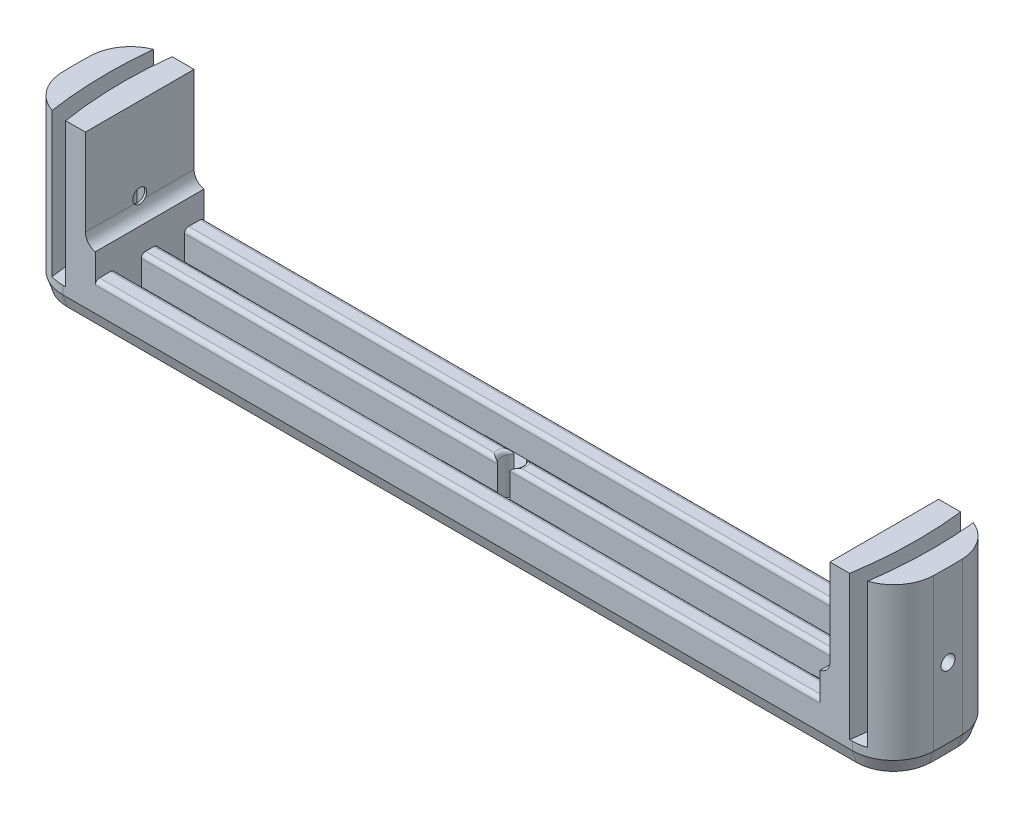
from build123d import *
from OCP.BRepFilletAPI import BRepFilletAPI_MakeChamfer

# Parameters (mm, degrees)
BOSS_EXTRUDE1_DEPTH = 40
SKETCH2_W           = 176.2
SKETCH2_H           = 6.5
CUT_EXTRUDE1_DEPTH  = 37
SKETCH3_W           = 60
SKETCH3_H           = 6.5
CUT_EXTRUDE2_DEPTH  = 115.330923201
SKETCH4_R           = 100.2
SKETCH4_R_2         = 96.5
CUT_EXTRUDE5_DEPTH  = 35
CUT_EXTRUDE6_START  = 120
SKETCH5_R           = 1.7
CUT_EXTRUDE6_DEPTH  = 36
CUT_EXTRUDE7_START  = 91
CUT_EXTRUDE7_DEPTH  = 3.2
FILLET2_R           = 1
SKETCH9_W           = 181
SKETCH9_H           = 28.8
CUT_EXTRUDE8_DEPTH  = 30
SKETCH10_W          = 2.4
SKETCH10_H          = 28.8
BOSS_EXTRUDE2_DEPTH = 6
FILLET4_R           = 3
SKETCH11_W          = 225.222817724
SKETCH11_H          = 17.602584952
CUT_EXTRUDE9_DEPTH  = 116.336724571
FILLET5_R           = 10
CHAMFER1_SIZE       = 3
CHAMFER1_SIZE2      = 1
SKETCH12_R          = 2.5
CUT_EXTRUDE10_DEPTH = 10
FILLET8_R           = 1


with BuildPart() as part:
    # Sketch1 → Boss-Extrude1 (new body)
    with BuildSketch(Plane(origin=(0, 0, 0), x_dir=(1, 0, 0), z_dir=(0, 1, 0))):
        with BuildLine():
            Line((-96.521484635, 7.2), (-106, 7.2))
            ThreePointArc((-106, 7.2), (-105.754047633, -0.016745052), (-105.017331903, -7.2))
            Line((-105.017331903, -7.2), (-96.521484635, -7.2))
            Line((-96.521484635, -7.2), (96.521484635, -7.2))
            Line((96.521484635, -7.2), (105.017331903, -7.2))
            ThreePointArc((105.017331903, -7.2), (105.754047633, -0.016745052), (106, 7.2))
            Line((106, 7.2), (96.521484635, 7.2))
            Line((96.521484635, 7.2), (-96.521484635, 7.2))
        make_face()
    boss_extrude1 = extrude(amount=BOSS_EXTRUDE1_DEPTH)

    # Mirror2: Boss-Extrude1 across plane
    add(boss_extrude1.mirror(Plane(origin=(0, 0, -7.2), x_dir=(1, 0, 0), z_dir=(0, 0, -1))))

    # Sketch2 → Cut-Extrude1 (cut)
    with BuildSketch(Plane(origin=(0, 40, 0), x_dir=(1, 0, 0), z_dir=(0, 1, 0))):
        with Locations((0, 1.95)):
            Rectangle(SKETCH2_W, SKETCH2_H)
    cut_extrude1 = extrude(amount=-CUT_EXTRUDE1_DEPTH, mode=Mode.SUBTRACT)

    # Mirror3: Cut-Extrude1 across plane
    add(cut_extrude1.mirror(Plane(origin=(0, 0, -7.2), x_dir=(1, 0, 0), z_dir=(0, 0, -1))), mode=Mode.SUBTRACT)

    # Sketch3 → Cut-Extrude2 (cut, through all)
    with BuildSketch(Plane(origin=(0, 3, 0), x_dir=(1, 0, 0), z_dir=(0, 1, 0))):
        with Locations((-45, 1.95)):
            Rectangle(SKETCH3_W, SKETCH3_H)
        with Locations((45, 1.95)):
            Rectangle(SKETCH3_W, SKETCH3_H)
    cut_extrude2 = extrude(amount=-CUT_EXTRUDE2_DEPTH, mode=Mode.SUBTRACT)

    # Mirror4: Cut-Extrude2 across plane
    add(cut_extrude2.mirror(Plane(origin=(0, 0, -7.2), x_dir=(1, 0, 0), z_dir=(0, 0, -1))), mode=Mode.SUBTRACT)

    # Sketch4 → Cut-Extrude5 (cut)
    with BuildSketch(Plane(origin=(0, 40, 0), x_dir=(1, 0, 0), z_dir=(0, 1, 0))):
        with Locations((0, 9.2)):
            Circle(SKETCH4_R)
        with Locations((0, 9.2)):
            Circle(SKETCH4_R_2, mode=Mode.SUBTRACT)
    extrude(amount=-CUT_EXTRUDE5_DEPTH, mode=Mode.SUBTRACT)

    # Sketch5 → Cut-Extrude6 (cut)
    with BuildSketch(Plane(origin=(0, 0, 0), x_dir=(0, 0, -1), z_dir=(1, 0, 0)).offset(CUT_EXTRUDE6_START)):
        with Locations((7.2, 20)):
            Circle(SKETCH5_R)
    cut_extrude6 = extrude(amount=-CUT_EXTRUDE6_DEPTH, mode=Mode.SUBTRACT)

    # Mirror5: Cut-Extrude6 across plane
    add(cut_extrude6.mirror(Plane(origin=(0, 0, 0), x_dir=(0, 0, 1), z_dir=(1, 0, 0))), mode=Mode.SUBTRACT)

    # Sketch6 → Cut-Extrude7 (cut)
    with BuildSketch(Plane(origin=(0, 0, 0), x_dir=(0, 0, -1), z_dir=(1, 0, 0)).offset(CUT_EXTRUDE7_START)):
        Polygon((4.15, 18.239081679), (4.15, 0), (10.25, 0), (10.25, 18.239081679), (10.25, 21.760918321), (7.2, 23.521836642), (4.15, 21.760918321), align=None)
    cut_extrude7 = extrude(amount=CUT_EXTRUDE7_DEPTH, mode=Mode.SUBTRACT)

    # Mirror6: Cut-Extrude7 across plane
    add(cut_extrude7.mirror(Plane(origin=(0, 0, 0), x_dir=(0, 0, 1), z_dir=(1, 0, 0))), mode=Mode.SUBTRACT)

    # Fillet2
    fillet2_edges = [part.edges().sort_by_distance(p)[0] for p in [
        (0, 40, 1.3),
        (0, 40, -15.7),
    ]]
    fillet(fillet2_edges, radius=FILLET2_R)

    # Sketch9 → Cut-Extrude8 (cut)
    with BuildSketch(Plane(origin=(0, 40, 0), x_dir=(1, 0, 0), z_dir=(0, 1, 0))):
        with Locations((0, 7.2)):
            Rectangle(SKETCH9_W, SKETCH9_H)
    extrude(amount=-CUT_EXTRUDE8_DEPTH, mode=Mode.SUBTRACT)

    # Sketch10 → Boss-Extrude2 (add)
    with BuildSketch(Plane(origin=(0, 10, 0), x_dir=(1, 0, 0), z_dir=(0, 1, 0))):
        with Locations((-89.3, 7.2)):
            Rectangle(SKETCH10_W, SKETCH10_H)
        with Locations((89.3, 7.2)):
            Rectangle(SKETCH10_W, SKETCH10_H)
    extrude(amount=BOSS_EXTRUDE2_DEPTH)

    # Fillet4
    # the kernel refuses this fillet: 3 mm, written as the material it adds along each edge
    with BuildSketch(Plane(origin=(90.5, 16, -21.6), x_dir=(0, 1, 0), z_dir=(0, 0, 1))) as fillet4_piece_1_section:
        with BuildLine():
            CenterArc((2.939387691, 3), FILLET4_R, 191.536959033, 78.463040967)
            Line((0, 2.4), (0, 0))
            Line((0, 0), (2.939387691, 0))
        make_face()
    fillet4_piece_1 = extrude(amount=28.8, mode=Mode.PRIVATE)
    fillet4_piece_1 = fillet4_piece_1 - Plane(origin=(90.5, 20, -7.2), x_dir=(0, 0, -1), z_dir=(1, 0, 0)) * Cylinder(1.7, 70, mode=Mode.PRIVATE)
    add(fillet4_piece_1)
    with BuildSketch(Plane(origin=(-90.5, 16, 7.2), x_dir=(1.0, 1.5765166949672332e-12, 0), z_dir=(0, 0, -1))) as fillet4_piece_2_section:
        with BuildLine():
            CenterArc((3, -2.939387691), FILLET4_R, 101.536959033, 78.463040967)
            Line((0, -2.939387691), (0, 0))
            Line((0, 0), (2.4, 0))
        make_face()
    fillet4_piece_2 = extrude(amount=28.8, mode=Mode.PRIVATE)
    fillet4_piece_2 = fillet4_piece_2 - Plane(origin=(-90.5, 20, -7.2), x_dir=(0, 0, -1), z_dir=(-1, 0, 0)) * Cylinder(1.7, 70, mode=Mode.PRIVATE)
    add(fillet4_piece_2)

    # Sketch11 → Cut-Extrude9 (cut, through all)
    with BuildSketch(Plane(origin=(0, 40, 0), x_dir=(1, 0, 0), z_dir=(0, 1, 0))):
        with Locations((0, -14.801292476)):
            Rectangle(SKETCH11_W, SKETCH11_H)
    cut_extrude9 = extrude(amount=-CUT_EXTRUDE9_DEPTH, mode=Mode.SUBTRACT)

    # Mirror7: Cut-Extrude9 across plane
    add(cut_extrude9.mirror(Plane(origin=(0, 0, -7.2), x_dir=(1, 0, 0), z_dir=(0, 0, -1))), mode=Mode.SUBTRACT)

    # Fillet5
    fillet5_edges = [part.edges().sort_by_distance(p)[0] for p in [
        (-105.174901949, 20, 6),
        (105.174901949, 20, 6),
        (-105.174901949, 20, -20.4),
        (105.174901949, 20, -20.4),
    ]]
    fillet(fillet5_edges, radius=FILLET5_R)

    # Chamfer1: one chamfer whose edges measure the first distance from different faces: ONE call of the kernel's chamfer builder (chamfer() names one face for all edges)
    chamfer1_edges_1 = [part.edges().sort_by_distance(p)[0] for p in [
        (0, 0, -20.4),
    ]]
    chamfer1_side_1 = [part.faces().sort_by_distance(p)[0] for p in [
        (0, 7.944189947, -20.4),
    ]]
    chamfer1_edges_2 = [part.edges().sort_by_distance(p)[0] for p in [
        (106, 0, -7.2),
    ]]
    chamfer1_side_2 = [part.faces().sort_by_distance(p)[0] for p in [
        (106, 20, -7.2),
    ]]
    chamfer1_edges_3 = [part.edges().sort_by_distance(p)[0] for p in [
        (0, 0, 6),
    ]]
    chamfer1_side_3 = [part.faces().sort_by_distance(p)[0] for p in [
        (0, 7.692045339, 6),
    ]]
    chamfer1_edges_4 = [part.edges().sort_by_distance(p)[0] for p in [
        (-106, 0, -7.2),
    ]]
    chamfer1_side_4 = [part.faces().sort_by_distance(p)[0] for p in [
        (-106, 20, -7.2),
    ]]
    chamfer1_edges_5 = [part.edges().sort_by_distance(p)[0] for p in [
        (-102.898869715, 0, 3.187952884),
    ]]
    chamfer1_side_5 = [part.faces().sort_by_distance(p)[0] for p in [
        (-102.898869715, 20, 3.187952884),
    ]]
    chamfer1_edges_6 = [part.edges().sort_by_distance(p)[0] for p in [
        (-102.898869715, 0, -17.587952884),
    ]]
    chamfer1_side_6 = [part.faces().sort_by_distance(p)[0] for p in [
        (-102.898869715, 20, -17.587952884),
    ]]
    chamfer1_edges_7 = [part.edges().sort_by_distance(p)[0] for p in [
        (102.898869715, 0, 3.187952884),
    ]]
    chamfer1_side_7 = [part.faces().sort_by_distance(p)[0] for p in [
        (102.898869715, 20, 3.187952884),
    ]]
    chamfer1_edges_8 = [part.edges().sort_by_distance(p)[0] for p in [
        (102.898869715, 0, -17.587952884),
    ]]
    chamfer1_side_8 = [part.faces().sort_by_distance(p)[0] for p in [
        (102.898869715, 20, -17.587952884),
    ]]
    chamfer1 = BRepFilletAPI_MakeChamfer(part.part.solid().wrapped)
    for e in chamfer1_edges_1:
        chamfer1.Add(CHAMFER1_SIZE, CHAMFER1_SIZE2, e.wrapped, chamfer1_side_1[0].wrapped)  # the first distance lies on this face
    for e in chamfer1_edges_2:
        chamfer1.Add(CHAMFER1_SIZE, CHAMFER1_SIZE2, e.wrapped, chamfer1_side_2[0].wrapped)  # the first distance lies on this face
    for e in chamfer1_edges_3:
        chamfer1.Add(CHAMFER1_SIZE, CHAMFER1_SIZE2, e.wrapped, chamfer1_side_3[0].wrapped)  # the first distance lies on this face
    for e in chamfer1_edges_4:
        chamfer1.Add(CHAMFER1_SIZE, CHAMFER1_SIZE2, e.wrapped, chamfer1_side_4[0].wrapped)  # the first distance lies on this face
    for e in chamfer1_edges_5:
        chamfer1.Add(CHAMFER1_SIZE, CHAMFER1_SIZE2, e.wrapped, chamfer1_side_5[0].wrapped)  # the first distance lies on this face
    for e in chamfer1_edges_6:
        chamfer1.Add(CHAMFER1_SIZE, CHAMFER1_SIZE2, e.wrapped, chamfer1_side_6[0].wrapped)  # the first distance lies on this face
    for e in chamfer1_edges_7:
        chamfer1.Add(CHAMFER1_SIZE, CHAMFER1_SIZE2, e.wrapped, chamfer1_side_7[0].wrapped)  # the first distance lies on this face
    for e in chamfer1_edges_8:
        chamfer1.Add(CHAMFER1_SIZE, CHAMFER1_SIZE2, e.wrapped, chamfer1_side_8[0].wrapped)  # the first distance lies on this face
    add(Compound.cast(chamfer1.Shape()), mode=Mode.REPLACE)

    # Sketch12 → Cut-Extrude10 (cut)
    with BuildSketch(Plane.XZ):
        with Locations(Location((0, -7.2, 0), (0, 0, 270))):
            Circle(SKETCH12_R)
    extrude(amount=-CUT_EXTRUDE10_DEPTH, mode=Mode.SUBTRACT)

    # Fillet8
    fillet8_edges = [part.edges().sort_by_distance(p)[0] for p in [
        (0, 10, -15.7),
        (0, 10, 1.3),
        (44.8, 10, -5.2),
        (44.8, 10, -9.2),
        (0, 10, 6),
        (0, 10, -20.4),
        (-44.8, 10, -9.2),
        (-44.8, 10, -5.2),
        (2.5, 10, -7.2),
        (-2.5, 10, -7.2),
    ]]
    fillet(fillet8_edges, radius=FILLET8_R)


solid = part.part
